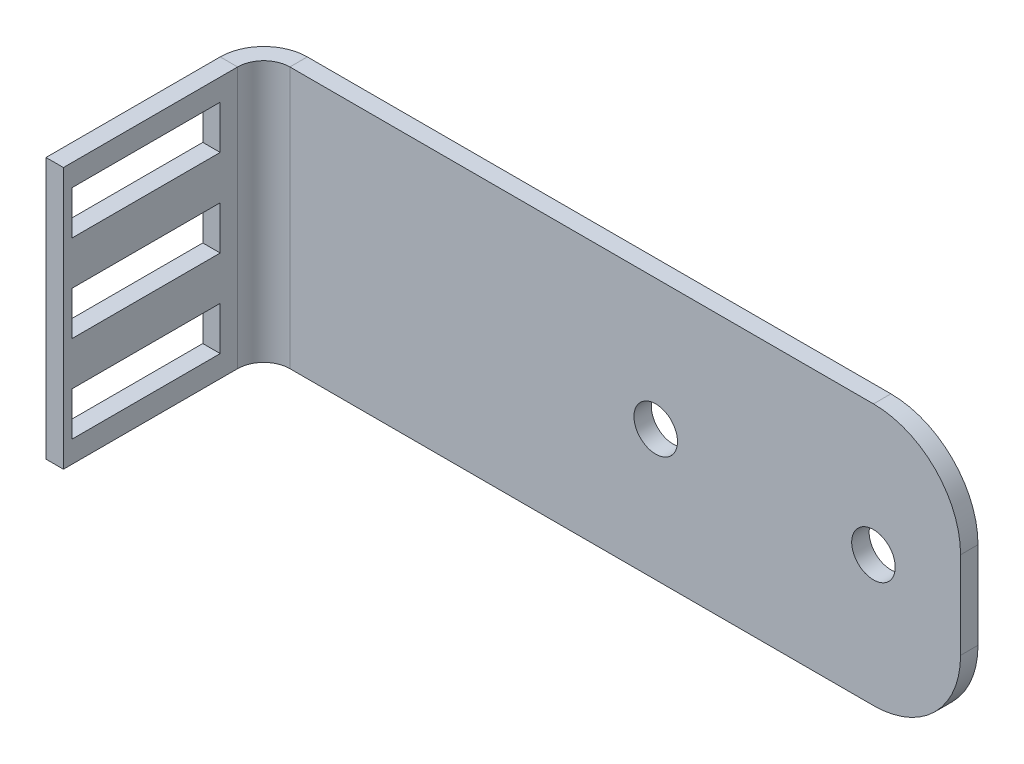
from build123d import *

# Parameters (mm, degrees)
SKETCH1_W                    = 80
SKETCH1_H                    = 30
SKETCH1_R                    = 2.5
BASE_FLANGE1_DEPTH           = 2
FILLET1_R                    = 10
EDGE_FLANGE1_STRIP_W         = 14
EDGE_FLANGE1_STRIP_H         = 2
EDGE_FLANGE1_STRIP_CUT_DEPTH = 30
EDGE_FLANGE1_DEPTH           = 30
SKETCH9_W                    = 17
SKETCH9_H                    = 5
CUT_EXTRUDE1_DEPTH           = 10


# Sheet-metal steps are written as plain solids
with BuildPart() as part:
    # Sketch1 → Base-Flange1 (new body)
    with BuildSketch(Plane.XY):
        Rectangle(SKETCH1_W, SKETCH1_H)
        with Locations((30, 0)):
            Circle(SKETCH1_R, mode=Mode.SUBTRACT)
        with Locations((5, 0)):
            Circle(SKETCH1_R, mode=Mode.SUBTRACT)
    extrude(amount=-BASE_FLANGE1_DEPTH)

    # Fillet1
    fillet1_edges = [part.edges().sort_by_distance(p)[0] for p in [
        (40, -15, -1),
        (40, 15, -1),
    ]]
    fillet(fillet1_edges, radius=FILLET1_R)

    # Edge-Flange1 strip (across the edge) → Edge-Flange1 strip cut (cut)
    with BuildSketch(Plane(origin=(-40, 15, 0), x_dir=(1, 0, 0), z_dir=(0, -1, 0))):
        with Locations((-4, -1)):
            Rectangle(EDGE_FLANGE1_STRIP_W, EDGE_FLANGE1_STRIP_H)
    extrude(amount=EDGE_FLANGE1_STRIP_CUT_DEPTH, mode=Mode.SUBTRACT)

    # Edge-Flange1 section (across the edge) → Edge-Flange1 (add)
    with BuildSketch(Plane(origin=(-40, 15, 0), x_dir=(1, 0, 0), z_dir=(0, -1, 0))):
        with BuildLine():
            Line((-2, 3), (-2, 23))
            Line((-2, 23), (0, 23))
            Line((0, 23), (0, 3))
            ThreePointArc((0, 3), (0.878679656, 0.878679656), (3, 0))
            Line((3, 0), (3, -2))
            ThreePointArc((3, -2), (-0.535533906, -0.535533906), (-2, 3))
        make_face()
    extrude(amount=EDGE_FLANGE1_DEPTH)

    # Sketch9 → Cut-Extrude1 (cut)
    with BuildSketch(Plane.ZY.offset(42)):
        with Locations((13.5, 10)):
            Rectangle(SKETCH9_W, SKETCH9_H)
        with Locations((13.5, 0)):
            Rectangle(SKETCH9_W, SKETCH9_H)
        with Locations((13.5, -10)):
            Rectangle(SKETCH9_W, SKETCH9_H)
    extrude(amount=-CUT_EXTRUDE1_DEPTH, mode=Mode.SUBTRACT)


solid = part.part
